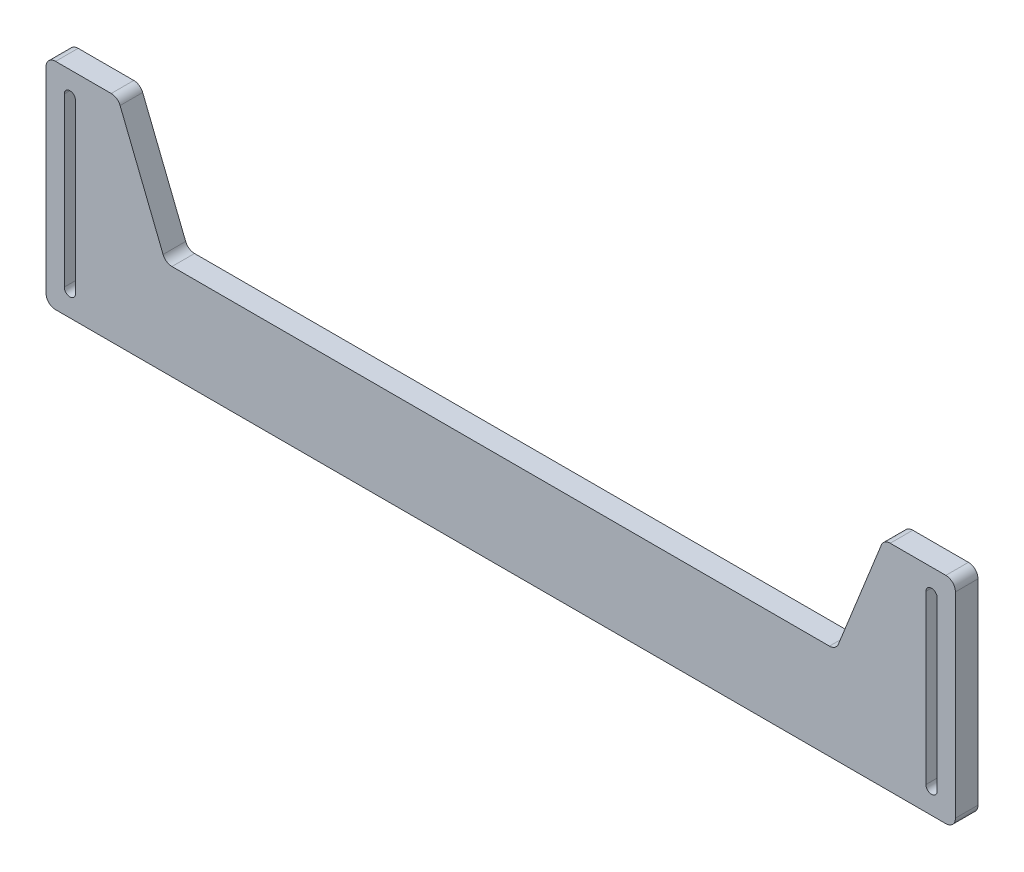
from build123d import *

# Parameters (mm, degrees)
BOSS_EXTRUDE1_DEPTH = 3
FILLET1_R           = 2.54


with BuildPart() as part:
    # Sketch1 → Boss-Extrude1 (new, symmetric)
    with BuildSketch(Plane.XY):
        Polygon((-120.825, -28.575), (-120.825, 28.575), (-101.775, 28.575), (-89.075, -3.175), (89.075, -3.175), (101.775, 28.575), (120.825, 28.575), (120.825, -28.575), align=None)
        with BuildLine():
            Line((-112.975, 22.225), (-112.975, -22.225))
            ThreePointArc((-112.975, -22.225), (-114.475, -23.725), (-115.975, -22.225))
            Line((-115.975, -22.225), (-115.975, 22.225))
            ThreePointArc((-115.975, 22.225), (-114.475, 23.725), (-112.975, 22.225))
        make_face(mode=Mode.SUBTRACT)
        with BuildLine():
            Line((115.975, 22.225), (115.975, -22.225))
            ThreePointArc((115.975, -22.225), (114.475, -23.725), (112.975, -22.225))
            Line((112.975, -22.225), (112.975, 22.225))
            ThreePointArc((112.975, 22.225), (114.475, 23.725), (115.975, 22.225))
        make_face(mode=Mode.SUBTRACT)
    extrude(amount=BOSS_EXTRUDE1_DEPTH, both=True)

    # Fillet1
    fillet1_edges = [part.edges().sort_by_distance(p)[0] for p in [
        (120.825, 28.575, 0),
        (120.825, -28.575, 0),
        (-120.825, -28.575, 0),
        (-101.775, 28.575, 0),
        (-89.075, -3.175, 0),
        (89.075, -3.175, 0),
        (101.775, 28.575, 0),
        (-120.825, 28.575, 0),
    ]]
    fillet(fillet1_edges, radius=FILLET1_R)


solid = part.part
